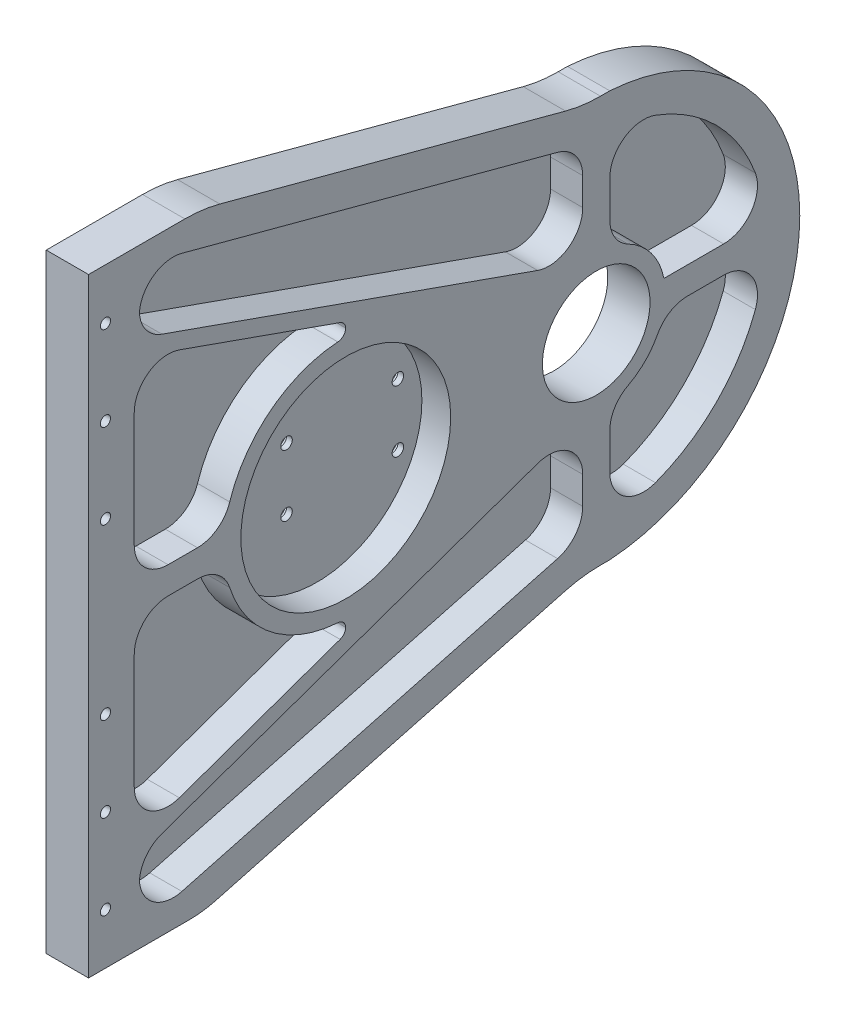
from build123d import *

# Parameters (mm, degrees)
BOSS_EXTRUDE1_DEPTH                           = 12.5
F_3_0MM_DOWEL_HOLE1_D                         = 3
SKETCH8_R                                     = 15.9
SKETCH8_R_2                                   = 31
CUT_EXTRUDE1_DEPTH                            = 176.374599073
CUT_EXTRUDE2_DEPTH                            = 176.374599073
FILLET1_R                                     = 10
FILLET1_R_2                                   = 40
FILLET1_R_3                                   = 30
FILLET2_R                                     = 2.5
BOSS_EXTRUDE2_START                           = -12.5
BOSS_EXTRUDE2_DEPTH                           = 3
BOSS_EXTRUDE2_2_DEPTH                         = 3
BOSS_EXTRUDE2_3_DEPTH                         = 3
BOSS_EXTRUDE2_4_DEPTH                         = 3
BOSS_EXTRUDE2_5_DEPTH                         = 3
BOSS_EXTRUDE2_6_DEPTH                         = 3
BOSS_EXTRUDE3_START                           = -4
SKETCH11_R                                    = 31
BOSS_EXTRUDE3_DEPTH                           = 4
CBORE_FOR_M3_HEX_HEAD_MACHINE_SCREW1_AT_COUNT = 2
CBORE_FOR_M3_HEX_HEAD_MACHINE_SCREW1_AT_PITCH = 18.2
CBORE_FOR_M3_HEX_HEAD_MACHINE_SCREW1_2_COUNT  = 2
CBORE_FOR_M3_HEX_HEAD_MACHINE_SCREW1_2_PITCH  = 37.598537206
CBORE_FOR_M3_HEX_HEAD_MACHINE_SCREW1_3_COUNT  = 2
CBORE_FOR_M3_HEX_HEAD_MACHINE_SCREW1_3_PITCH  = 32.9


with BuildPart() as part:
    # Sketch1 → Boss-Extrude1 (new body)
    with BuildSketch(Plane(origin=(0, 0, 0), x_dir=(0, 0, -1), z_dir=(1, 0, 0))):
        with BuildLine():
            Line((0, 90), (-150, 90))
            Line((-150, 90), (-150, -90))
            Line((-150, -90), (0, -90))
            ThreePointArc((0, -90), (90, 0), (0, 90))
        make_face()
    extrude(amount=BOSS_EXTRUDE1_DEPTH)

    # Ø3.0mm Dowel Hole1 (through all)
    with Locations(Plane(origin=(12.5, 0, 0), x_dir=(0, 0, -1), z_dir=(1, 0, 0))):
        with Locations((-145, -75), (-145, -50), (-145, -25), (-145, 25), (-145, 50), (-145, 75)):
            Hole(F_3_0MM_DOWEL_HOLE1_D / 2)

    # Sketch8 → Cut-Extrude1 (cut, through all)
    with BuildSketch(Plane(origin=(12.5, 0, 0), x_dir=(0, 0, -1), z_dir=(1, 0, 0))):
        Circle(SKETCH8_R)
        with Locations((-74, 0)):
            Circle(SKETCH8_R_2)
    extrude(amount=-CUT_EXTRUDE1_DEPTH, mode=Mode.SUBTRACT)

    # Sketch9 → Cut-Extrude2 (cut, through all)
    with BuildSketch(Plane(origin=(12.5, 0, 0), x_dir=(0, 0, -1), z_dir=(1, 0, 0))):
        with BuildLine():
            Line((4, 50), (4, 20))
            ThreePointArc((4, 20), (14.422205102, 14.422205102), (20, 4))
            Line((20, 4), (50, 4))
            ThreePointArc((50, 4), (35.468295702, 35.468295702), (4, 50))
        make_face()
        with BuildLine():
            ThreePointArc((20, -4), (14.422205102, -14.422205102), (4, -20))
            Line((4, -20), (4, -50))
            ThreePointArc((4, -50), (35.468295702, -35.468295702), (50, -4))
            Line((50, -4), (20, -4))
        make_face()
        Polygon((-4, 20), (-4, 50), (-135, 85), (-135, 66.25), align=None)
        Polygon((-4, -50), (-4, -20), (-135, -66.25), (-135, -85), align=None)
        with BuildLine():
            Line((-109.77708764, -4), (-136.498114106, -4))
            Line((-136.498114106, -4), (-136.498114106, -62.00669302))
            Line((-136.498114106, -62.00669302), (-74, -39.941519147))
            Line((-74, -39.941519147), (-74, -36))
            ThreePointArc((-74, -36), (-98, -26.83281573), (-109.77708764, -4))
        make_face()
        with BuildLine():
            Line((-74, 39.941519147), (-136.498114106, 62.00669302))
            Line((-136.498114106, 62.00669302), (-136.498114106, 4))
            Line((-136.498114106, 4), (-109.77708764, 4))
            ThreePointArc((-109.77708764, 4), (-98, 26.83281573), (-74, 36))
            Line((-74, 36), (-74, 39.941519147))
        make_face()
        with BuildLine():
            Line((-116.285714286, 90), (-4, 60))
            Line((-4, 60), (4, 60))
            ThreePointArc((4, 60), (60.133185513, 0), (4, -60))
            Line((4, -60), (-4, -60))
            Line((-4, -60), (-116.285714286, -90))
            Line((-116.285714286, -90), (0, -90))
            ThreePointArc((0, -90), (90, 0), (0, 90))
            Line((0, 90), (-116.285714286, 90))
        make_face()
    extrude(amount=-CUT_EXTRUDE2_DEPTH, mode=Mode.SUBTRACT)

    # Fillet1
    # the kernel refuses this fillet: 40, 30, 10 mm, written as the material it adds along each edge
    with BuildSketch(Plane(origin=(12.5, 50, 4), x_dir=(0, -1, 0), z_dir=(-1, 0, 0))) as fillet1_piece_1:
        with BuildLine():
            CenterArc((FILLET1_R * 0.767900650061, FILLET1_R), FILLET1_R, 194.958636074, 75.041363926)
            Line((-FILLET1_R * 0.198211775464, FILLET1_R * 0.741878359593), (0, 0))
            Line((0, 0), (FILLET1_R * 0.767900650061, 0))
        make_face()
    extrude(amount=12.5)
    with BuildSketch(Plane(origin=(12.5, -50, 4), x_dir=(0, 1, 0), z_dir=(-1, 0, 0))) as fillet1_piece_2:
        with BuildLine():
            CenterArc((FILLET1_R * 0.767900650061, -FILLET1_R), FILLET1_R, 90, 75.041363926)
            Line((-FILLET1_R * 0.198211775464, -FILLET1_R * 0.741878359593), (0, 0))
            Line((0, 0), (FILLET1_R * 0.767900650061, 0))
        make_face()
    extrude(amount=12.5)
    with BuildSketch(Plane(origin=(12.5, 85, 135), x_dir=(0, -0.25812164040738717, -0.9661124255247934), z_dir=(-1, 0, 0)), Plane(origin=(12.5, -85, 135), x_dir=(0, 1, 0), z_dir=(-1, 0, 0))) as fillet1_piece_3:
        with BuildLine():
            CenterArc((FILLET1_R * 1.3022517951, FILLET1_R), FILLET1_R, 165.041363926, 104.958636074)
            Line((FILLET1_R * 0.336139369574, FILLET1_R * 1.25812164041), (0, 0))
            Line((0, 0), (FILLET1_R * 1.3022517951, 0))
        make_face()
    extrude(amount=12.5)
    with BuildSketch(Plane(origin=(12.5, 66.25, 135), x_dir=(0, 1, 0), z_dir=(-1, 0, 0)), Plane(origin=(12.5, -66.25, 135), x_dir=(0, 0.3329142456766202, -0.9429571066732394), z_dir=(-1, 0, 0))) as fillet1_piece_4:
        with BuildLine():
            CenterArc((FILLET1_R * 0.707440189593, FILLET1_R), FILLET1_R, 199.445754111, 70.554245889)
            Line((-FILLET1_R * 0.23551691708, FILLET1_R * 0.667085754323), (0, 0))
            Line((0, 0), (FILLET1_R * 0.707440189593, 0))
        make_face()
    extrude(amount=12.5)
    with BuildSketch(Plane(origin=(12.5, -20, 4), x_dir=(0, -1, 0), z_dir=(-1, 0, 0)), Plane(origin=(12.5, 62.00669302, 136.498114106), x_dir=(0, -0.33291424567662004, -0.9429571066732394), z_dir=(-1, 0, 0)), Plane(origin=(12.5, -62.00669302, 136.498114106), x_dir=(0, 1, 0), z_dir=(-1, 0, 0))) as fillet1_piece_5:
        with BuildLine():
            CenterArc((FILLET1_R * 1.41354705982, FILLET1_R), FILLET1_R, 160.554245889, 109.445754111)
            Line((FILLET1_R * 0.470589953149, FILLET1_R * 1.33291424568), (0, 0))
            Line((0, 0), (FILLET1_R * 1.41354705982, 0))
        make_face()
    extrude(amount=12.5)
    with BuildSketch(Plane(origin=(12.5, -20, -4), x_dir=(0, 0.33162475941488073, -0.9434113731257551), z_dir=(-1, 0, 0))) as fillet1_piece_6:
        with BuildLine():
            CenterArc((7.119365775, 9.901279278), FILLET1_R, 199.367421474, 62.575089526)
            Line((-2.314747956, 6.585031684), (0, 0))
            ThreePointArc((0, 0), (2.858849696, 0.201351554), (5.717699392, 0))
        make_face()
    extrude(amount=12.5)
    with BuildSketch(Plane(origin=(12.5, 20, -4), x_dir=(0, 1, 0), z_dir=(-1, 0, 0)), Plane(origin=(12.5, -4, -20), x_dir=(0, 0, -1), z_dir=(-1, 0, 0))) as fillet1_piece_7:
        with BuildLine():
            CenterArc((6.980021518, 10), FILLET1_R, 207.424910474, 62.575089526)
            ThreePointArc((-1.896130685, 5.394142634), (-0.758107996, 2.763844478), (0, 0))
            Line((0, 0), (6.980021518, 0))
        make_face()
    extrude(amount=12.5)
    with BuildSketch(Plane(origin=(12.5, 20, 4), x_dir=(0, 1, 0), z_dir=(-1, 0, 0))) as fillet1_piece_8:
        with BuildLine():
            CenterArc((FILLET1_R * 1.41354705982, -FILLET1_R), FILLET1_R, 90, 109.445754111)
            Line((FILLET1_R * 0.470589953149, -FILLET1_R * 1.33291424568), (0, 0))
            Line((0, 0), (FILLET1_R * 1.41354705982, 0))
        make_face()
    extrude(amount=12.5)
    with BuildSketch(Plane(origin=(12.5, 4, 136.498114106), x_dir=(0, 1, 0), z_dir=(-1, 0, 0)), Plane(origin=(12.5, -4, 136.498114106), x_dir=(0, 0, -1), z_dir=(-1, 0, 0))) as fillet1_piece_9:
        with BuildLine():
            CenterArc((FILLET1_R, FILLET1_R), FILLET1_R, 180, 90)
            Line((0, FILLET1_R), (0, 0))
            Line((0, 0), (FILLET1_R, 0))
        make_face()
    extrude(amount=12.5)
    with BuildSketch(Plane(origin=(12.5, 4, 109.77708764), x_dir=(0, 0, 1), z_dir=(-1, 0, 0))) as fillet1_piece_10:
        with BuildLine():
            CenterArc((8.04071696, 10), FILLET1_R, 197.718931873, 72.281068127)
            ThreePointArc((-1.484892735, 6.956521739), (-0.570207804, 3.515025765), (0, 0))
            Line((0, 0), (8.04071696, 0))
        make_face()
    extrude(amount=12.5)
    with BuildSketch(Plane(origin=(12.5, -4, 109.77708764), x_dir=(0, 0, 1), z_dir=(-1, 0, 0))) as fillet1_piece_11:
        with BuildLine():
            CenterArc((8.04071696, -10), FILLET1_R, 90, 72.281068127)
            ThreePointArc((-1.484892735, -6.956521739), (-0.570207804, -3.515025765), (0, 0))
            Line((0, 0), (8.04071696, 0))
        make_face()
    extrude(amount=12.5)
    with BuildSketch(Plane(origin=(12.5, 50, -4), x_dir=(0, -0.21623604066929303, -0.9763411159608448), z_dir=(-1, 0, 0)), Plane(origin=(12.5, -4, -50), x_dir=(0, -0.9763411159608449, 0.21623604066929253), z_dir=(-1, 0, 0))) as fillet1_piece_12:
        with BuildLine():
            CenterArc((12.435986641, 9.904755326), FILLET1_R, 167.511946807, 110.402185127)
            Line((2.672575482, 12.067115733), (0, 0))
            ThreePointArc((0, 0), (6.90643757, -0.477744855), (13.812875139, 0))
        make_face()
    extrude(amount=12.5)
    with BuildSketch(Plane(origin=(12.5, -50, -4), x_dir=(0, 0.21623604066929225, -0.9763411159608449), z_dir=(-1, 0, 0)), Plane(origin=(12.5, 4, -50), x_dir=(0, 0.9763411159608448, 0.216236040669293), z_dir=(-1, 0, 0))) as fillet1_piece_13:
        with BuildLine():
            CenterArc((12.435986641, -9.904755326), FILLET1_R, 82.085868067, 110.402185127)
            Line((2.672575482, -12.067115733), (0, 0))
            ThreePointArc((0, 0), (6.90643757, 0.477744855), (13.812875139, 0))
        make_face()
    extrude(amount=12.5)
    with BuildSketch(Plane(origin=(12.5, -60, 4), x_dir=(0, 0, -1), z_dir=(-1, 0, 0)), Plane(origin=(12.5, 60, 4), x_dir=(0, 0.2581216404073864, 0.9661124255247937), z_dir=(-1, 0, 0))) as fillet1_piece_14:
        with BuildLine():
            CenterArc((FILLET1_R_2 * 0.131285290229, FILLET1_R_2), FILLET1_R_2, 255.041363926, 14.958636074)
            Line((-FILLET1_R_2 * 0.126836350179, FILLET1_R_2 * 0.0338875744752), (0, 0))
            Line((0, 0), (FILLET1_R_2 * 0.131285290229, 0))
        make_face()
    extrude(amount=12.5)
    # the kernel refuses this fillet: 40, 30, 10 mm, written as the material it takes off along each edge
    with BuildSketch(Plane(origin=(25.628529023, 90, 116.285714286), x_dir=(0, 0, 1), z_dir=(-1, 0, 0))) as fillet1_2_piece_1:
        with BuildLine():
            CenterArc((FILLET1_R_2 * 0.131285290229, -FILLET1_R_2), FILLET1_R_2, 90, 14.958636074)
            Line((-FILLET1_R_2 * 0.126836350179, -FILLET1_R_2 * 0.0338875744752), (0, 0))
            Line((0, 0), (FILLET1_R_2 * 0.131285290229, 0))
        make_face()
    extrude(amount=38.757058046, mode=Mode.SUBTRACT)
    with BuildSketch(Plane(origin=(22.346396767, -90, 116.285714286), x_dir=(0, 0.2581216404073897, -0.9661124255247927), z_dir=(-1, 0, 0))) as fillet1_2_piece_2:
        with BuildLine():
            CenterArc((FILLET1_R_3 * 0.131285290229, -FILLET1_R_3), FILLET1_R_3, 90, 14.958636074)
            Line((-FILLET1_R_3 * 0.126836350179, -FILLET1_R_3 * 0.0338875744752), (0, 0))
            Line((0, 0), (FILLET1_R_3 * 0.131285290229, 0))
        make_face()
    extrude(amount=32.192793534, mode=Mode.SUBTRACT)

    # Fillet2
    # the kernel refuses this fillet: 2.5 mm, written as the material it adds along each edge
    with BuildSketch(Plane(origin=(12.5, 39.941519147, 74), x_dir=(0, -1, 0), z_dir=(-1, 0, 0))) as fillet2_piece_1:
        with BuildLine():
            CenterArc((FILLET2_R * 0.707440189593, FILLET2_R), FILLET2_R, 199.445754111, 70.554245889)
            Line((-FILLET2_R * 0.23551691708, FILLET2_R * 0.667085754323), (0, 0))
            Line((0, 0), (FILLET2_R * 0.707440189593, 0))
        make_face()
    extrude(amount=12.5)
    with BuildSketch(Plane(origin=(12.5, 36, 74), x_dir=(0, -0.032484676787856784, 0.9994722336183174), z_dir=(-1, 0, 0))) as fillet2_piece_2:
        with BuildLine():
            CenterArc((2.420108421, 2.498680584), FILLET2_R, 181.86156238, 86.276875239)
            Line((-0.078572163, 2.417468892), (0, 0))
            ThreePointArc((0, 0), (1.169448364, 0.01899959), (2.338896729, 0))
        make_face()
    extrude(amount=12.5)
    with BuildSketch(Plane(origin=(12.5, -39.941519147, 74), x_dir=(0, 1, 0), z_dir=(-1, 0, 0))) as fillet2_piece_3:
        with BuildLine():
            CenterArc((FILLET2_R * 0.707440189593, -FILLET2_R), FILLET2_R, 90, 70.554245889)
            Line((-FILLET2_R * 0.23551691708, -FILLET2_R * 0.667085754323), (0, 0))
            Line((0, 0), (FILLET2_R * 0.707440189593, 0))
        make_face()
    extrude(amount=12.5)
    with BuildSketch(Plane(origin=(12.5, -36, 74), x_dir=(0, 0.032484676787853946, 0.9994722336183176), z_dir=(-1, 0, 0))) as fillet2_piece_4:
        with BuildLine():
            CenterArc((2.420108421, -2.498680584), FILLET2_R, 91.86156238, 86.27687524)
            Line((-0.078572163, -2.417468892), (0, 0))
            ThreePointArc((0, 0), (1.169448364, -0.01899959), (2.338896729, 0))
        make_face()
    extrude(amount=12.5)

    # Sketch11 → Boss-Extrude3 (add)
    with BuildSketch(Plane.ZY.offset(BOSS_EXTRUDE3_START)):
        with Locations(Location((74, 0, 0), (0, 0, 180))):
            Circle(SKETCH11_R)
    extrude(amount=BOSS_EXTRUDE3_DEPTH)

    # Sketch16 → CBORE for M3 Hex Head Machine Screw1 (revolve, cut)
    with BuildSketch(Plane(origin=(0, -9.1, 83), x_dir=(0, 0, 1), z_dir=(0, 1, 0))):
        Polygon((0, 0), (0, 12.5), (1.7, 12.5), (1.7, 2.3), (4.2, 2.3), (4.2, 0), align=None)
    cbore_for_m3_hex_head_machine_screw1 = revolve(axis=Axis((-6.35, -9.1, 83), (1, 0, 0)), mode=Mode.SUBTRACT)

    # CBORE for M3 Hex Head Machine Screw1 at: CBORE for M3 Hex Head Machine Screw1 ×2
    with Locations(*[(0, i * CBORE_FOR_M3_HEX_HEAD_MACHINE_SCREW1_AT_PITCH, 0) for i in range(1, CBORE_FOR_M3_HEX_HEAD_MACHINE_SCREW1_AT_COUNT)]):
        add(cbore_for_m3_hex_head_machine_screw1, mode=Mode.SUBTRACT)

    # CBORE for M3 Hex Head Machine Screw1 2: CBORE for M3 Hex Head Machine Screw1 ×2
    with Locations(*[Vector(0, 0.4840613851672659, -0.8750340424177495) * (i * CBORE_FOR_M3_HEX_HEAD_MACHINE_SCREW1_2_PITCH) for i in range(1, CBORE_FOR_M3_HEX_HEAD_MACHINE_SCREW1_2_COUNT)]):
        add(cbore_for_m3_hex_head_machine_screw1, mode=Mode.SUBTRACT)

    # CBORE for M3 Hex Head Machine Screw1 3: CBORE for M3 Hex Head Machine Screw1 ×2
    with Locations(*[(0, 0, -i * CBORE_FOR_M3_HEX_HEAD_MACHINE_SCREW1_3_PITCH) for i in range(1, CBORE_FOR_M3_HEX_HEAD_MACHINE_SCREW1_3_COUNT)]):
        add(cbore_for_m3_hex_head_machine_screw1, mode=Mode.SUBTRACT)


with BuildPart() as body_2:
    # Sketch10 → Boss-Extrude2 (new body)
    with BuildSketch(Plane(origin=(12.5, 0, 0), x_dir=(0, 0, -1), z_dir=(1, 0, 0)).offset(BOSS_EXTRUDE2_START)):
        with BuildLine():
            ThreePointArc((17.486077928, 47.01315857), (8.293020908, 45.852072537), (4, 37.640471619))
            Line((4, 37.640471619), (4, 26.980021518))
            ThreePointArc((4, 26.980021518), (5.454282544, 21.786687986), (9.394142634, 18.103869315))
            ThreePointArc((9.394142634, 18.103869315), (16.301340059, 12.258316046), (20, 4))
            Line((20, 4), (37.640471619, 4))
            ThreePointArc((37.640471619, 4), (45.852072537, 8.293020908), (47.01315857, 17.486077928))
            ThreePointArc((47.01315857, 17.486077928), (35.468295702, 35.468295702), (17.486077928, 47.01315857))
        make_face()
    extrude(amount=BOSS_EXTRUDE2_DEPTH)


with BuildPart() as body_3:
    # Sketch10 → Boss-Extrude2 2 (new body)
    with BuildSketch(Plane(origin=(12.5, 0, 0), x_dir=(0, 0, -1), z_dir=(1, 0, 0)).offset(BOSS_EXTRUDE2_START)):
        with BuildLine():
            ThreePointArc((47.01315857, -17.486077928), (45.852072537, -8.293020908), (37.640471619, -4))
            Line((37.640471619, -4), (26.980021518, -4))
            ThreePointArc((26.980021518, -4), (21.786687986, -5.454282544), (18.103869315, -9.394142634))
            ThreePointArc((18.103869315, -9.394142634), (14.422205102, -14.422205102), (9.394142634, -18.103869315))
            ThreePointArc((9.394142634, -18.103869315), (5.454282544, -21.786687986), (4, -26.980021518))
            Line((4, -26.980021518), (4, -37.640471619))
            ThreePointArc((4, -37.640471619), (8.293020908, -45.852072537), (17.486077928, -47.01315857))
            ThreePointArc((17.486077928, -47.01315857), (35.468295702, -35.468295702), (47.01315857, -17.486077928))
        make_face()
    extrude(amount=BOSS_EXTRUDE2_2_DEPTH)


with BuildPart() as body_4:
    # Sketch10 → Boss-Extrude2 3 (new body)
    with BuildSketch(Plane(origin=(12.5, 0, 0), x_dir=(0, 0, -1), z_dir=(1, 0, 0)).offset(BOSS_EXTRUDE2_START)):
        with BuildLine():
            ThreePointArc((-4, -34.135470598), (-8.22468289, -25.971788078), (-17.329142457, -24.705899531))
            Line((-17.329142457, -24.705899531), (-128.329142457, -63.894830829))
            ThreePointArc((-128.329142457, -63.894830829), (-132.964464961, -67.277311861), (-134.977296815, -72.650941972))
            ThreePointArc((-134.977296815, -72.650941972), (-130.819796293, -80.109515688), (-122.418783596, -81.638606304))
            Line((-122.418783596, -81.638606304), (-11.418783596, -51.982117755))
            ThreePointArc((-11.418783596, -51.982117755), (-6.06866455, -48.411471147), (-4, -42.320993499))
            Line((-4, -42.320993499), (-4, -34.135470598))
        make_face()
    extrude(amount=BOSS_EXTRUDE2_3_DEPTH)


with BuildPart() as body_5:
    # Sketch10 → Boss-Extrude2 4 (new body)
    with BuildSketch(Plane(origin=(12.5, 0, 0), x_dir=(0, 0, -1), z_dir=(1, 0, 0)).offset(BOSS_EXTRUDE2_START)):
        with BuildLine():
            ThreePointArc((-4, 42.320993499), (-6.06866455, 48.411471147), (-11.418783596, 51.982117755))
            Line((-11.418783596, 51.982117755), (-122.418783596, 81.638606304))
            ThreePointArc((-122.418783596, 81.638606304), (-130.819796293, 80.109515688), (-134.977296815, 72.650941972))
            ThreePointArc((-134.977296815, 72.650941972), (-132.964464961, 67.277311861), (-128.329142457, 63.894830829))
            Line((-128.329142457, 63.894830829), (-17.329142457, 24.705899531))
            ThreePointArc((-17.329142457, 24.705899531), (-8.22468289, 25.971788078), (-4, 34.135470598))
            Line((-4, 34.135470598), (-4, 42.320993499))
        make_face()
    extrude(amount=BOSS_EXTRUDE2_4_DEPTH)


with BuildPart() as body_6:
    # Sketch10 → Boss-Extrude2 5 (new body)
    with BuildSketch(Plane(origin=(12.5, 0, 0), x_dir=(0, 0, -1), z_dir=(1, 0, 0)).offset(BOSS_EXTRUDE2_START)):
        with BuildLine():
            ThreePointArc((-136.498114106, 14), (-133.569181917, 6.928932188), (-126.498114106, 4))
            Line((-126.498114106, 4), (-117.8178046, 4))
            ThreePointArc((-117.8178046, 4), (-111.920126354, 5.924271469), (-108.292194905, 10.956521739))
            ThreePointArc((-108.292194905, 10.956521739), (-96.164851092, 28.36757614), (-76.337662338, 35.924021696))
            ThreePointArc((-76.337662338, 35.924021696), (-74.718326849, 36.664994934), (-74.003023368, 38.295832049))
            ThreePointArc((-74.003023368, 38.295832049), (-74.495200431, 39.666497826), (-75.667714386, 40.53031144))
            Line((-75.667714386, 40.53031144), (-123.168971649, 57.300793488))
            ThreePointArc((-123.168971649, 57.300793488), (-132.273431215, 56.034904942), (-136.498114106, 47.871222422))
            Line((-136.498114106, 47.871222422), (-136.498114106, 14))
        make_face()
    extrude(amount=BOSS_EXTRUDE2_5_DEPTH)


with BuildPart() as body_7:
    # Sketch10 → Boss-Extrude2 6 (new body)
    with BuildSketch(Plane(origin=(12.5, 0, 0), x_dir=(0, 0, -1), z_dir=(1, 0, 0)).offset(BOSS_EXTRUDE2_START)):
        with BuildLine():
            ThreePointArc((-126.498114106, -4), (-133.569181917, -6.928932188), (-136.498114106, -14))
            Line((-136.498114106, -14), (-136.498114106, -47.871222422))
            ThreePointArc((-136.498114106, -47.871222422), (-132.273431215, -56.034904942), (-123.168971649, -57.300793488))
            Line((-123.168971649, -57.300793488), (-75.667714386, -40.53031144))
            ThreePointArc((-75.667714386, -40.53031144), (-74.495200431, -39.666497826), (-74.003023368, -38.295832049))
            ThreePointArc((-74.003023368, -38.295832049), (-74.718326849, -36.664994934), (-76.337662338, -35.924021696))
            ThreePointArc((-76.337662338, -35.924021696), (-96.164851092, -28.36757614), (-108.292194905, -10.956521739))
            ThreePointArc((-108.292194905, -10.956521739), (-111.920126354, -5.924271469), (-117.8178046, -4))
            Line((-117.8178046, -4), (-126.498114106, -4))
        make_face()
    extrude(amount=BOSS_EXTRUDE2_6_DEPTH)


solid = Compound([part.part, body_2.part, body_3.part, body_4.part, body_5.part, body_6.part, body_7.part])
